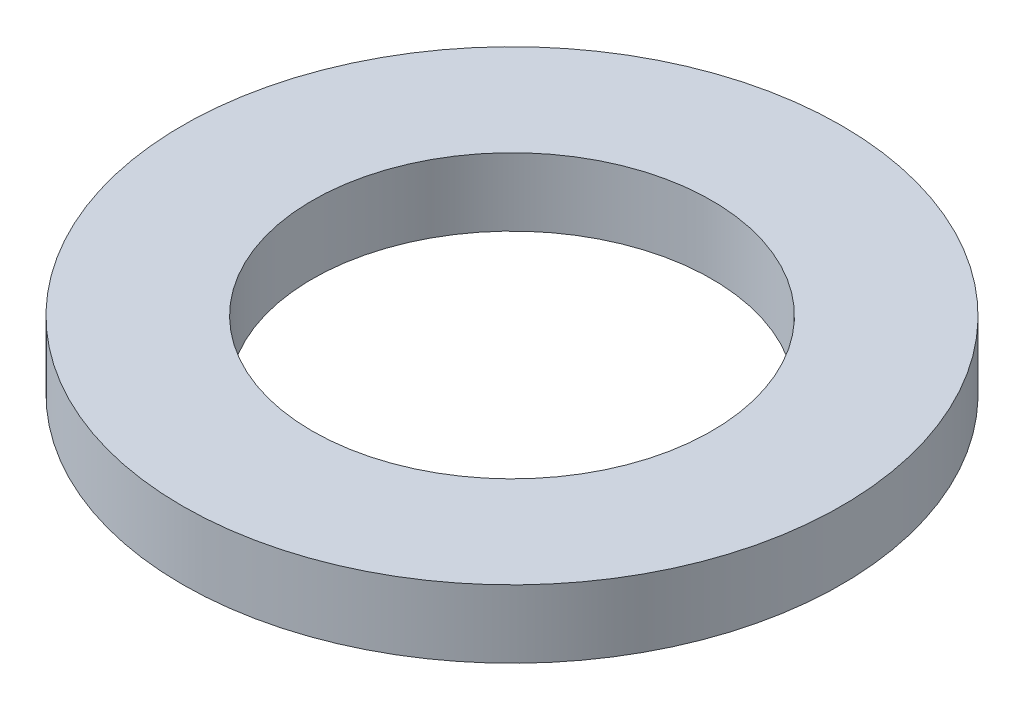
from build123d import *

# Parameters (mm, degrees)
SKETCH1_R           = 82.5
BOSS_EXTRUDE1_DEPTH = 17
SKETCH2_R           = 50
CUT_EXTRUDE1_DEPTH  = 118.904622471


with BuildPart() as part:
    # Sketch1 → Boss-Extrude1 (new body)
    with BuildSketch(Plane(origin=(0, 0, 0), x_dir=(1, 0, 0), z_dir=(0, 1, 0))):
        Circle(SKETCH1_R)
    extrude(amount=BOSS_EXTRUDE1_DEPTH)

    # Sketch2 → Cut-Extrude1 (cut, through all)
    with BuildSketch(Plane(origin=(0, 0, 0), x_dir=(1, 0, 0), z_dir=(0, 1, 0))):
        Circle(SKETCH2_R)
    extrude(amount=CUT_EXTRUDE1_DEPTH, mode=Mode.SUBTRACT)


solid = part.part
